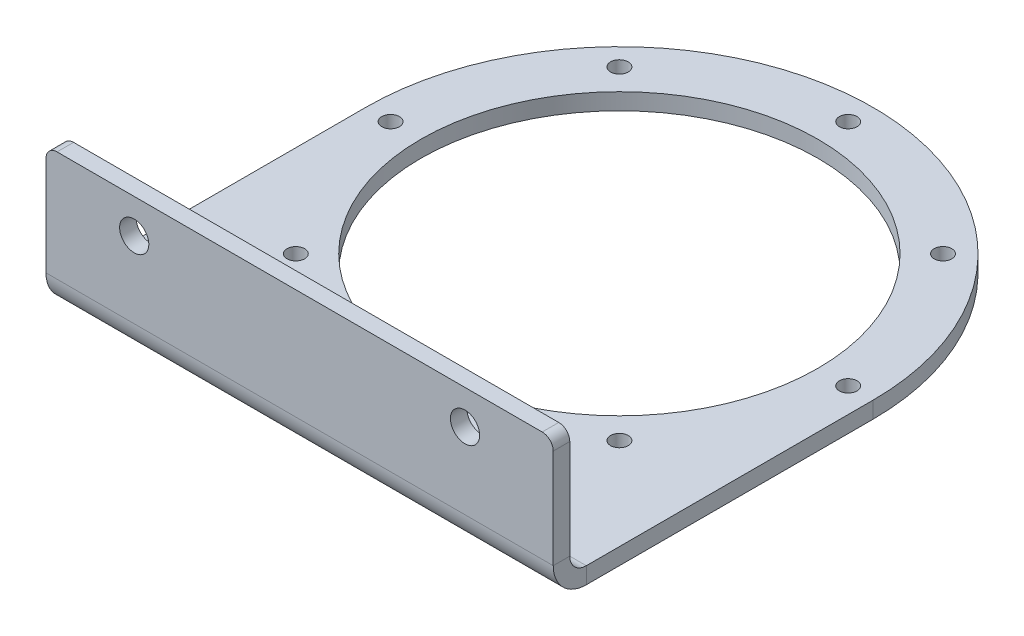
from build123d import *

# Parameters (mm, degrees)
SKETCH1_R                    = 36
SKETCH1_R_2                  = 1
BASE_FLANGE1_DEPTH           = 3
EDGE_FLANGE1_STRIP_W         = 18
EDGE_FLANGE1_STRIP_H         = 3
EDGE_FLANGE1_STRIP_CUT_DEPTH = 92
EDGE_FLANGE1_DEPTH           = 92
EDGE_FLANGE1_START           = 3
EDGE_FLANGE1_PROFILE_W       = 92
EDGE_FLANGE1_PROFILE_H       = 20
EDGE_FLANGE1_PROFILE_R       = 1
EDGE_FLANGE1_FLAT_DEPTH      = 3
FILLET1_R                    = 2
M3_CLEARANCE_HOLE1_D         = 3.2
M3_CLEARANCE_HOLE1_DEPTH     = 136
M3_CLEARANCE_HOLE1_TIP       = 0.96137699
M5_CLEARANCE_HOLE1_D         = 5.3
M5_CLEARANCE_HOLE1_DEPTH     = 136
M5_CLEARANCE_HOLE1_TIP       = 1.59228064


# Sheet-metal steps are written as plain solids
with BuildPart() as part:
    # Sketch1 → Base-Flange1 (new body)
    with BuildSketch(Plane(origin=(0, 0, 0), x_dir=(1, 0, 0), z_dir=(0, 1, 0))):
        with BuildLine():
            Line((-46, 0), (-46, -55))
            Line((-46, -55), (46, -55))
            Line((46, -55), (46, 0))
            ThreePointArc((46, 0), (0, 46), (-46, 0))
        make_face()
        with Locations(Location((0, 0, 0), (0, 0, 270))):
            Circle(SKETCH1_R, mode=Mode.SUBTRACT)
        with Locations(Location((0, 41.5, 0), (0, 0, 270))):
            Circle(SKETCH1_R_2, mode=Mode.SUBTRACT)
        with Locations(Location((29.344931419, 29.344931419, 0), (0, 0, 270))):
            Circle(SKETCH1_R_2, mode=Mode.SUBTRACT)
        with Locations(Location((41.5, 0, 0), (0, 0, 270))):
            Circle(SKETCH1_R_2, mode=Mode.SUBTRACT)
        with Locations(Location((29.344931419, -29.344931419, 0), (0, 0, 270))):
            Circle(SKETCH1_R_2, mode=Mode.SUBTRACT)
        with Locations(Location((0, -41.5, 0), (0, 0, 270))):
            Circle(SKETCH1_R_2, mode=Mode.SUBTRACT)
        with Locations(Location((-29.344931419, -29.344931419, 0), (0, 0, 270))):
            Circle(SKETCH1_R_2, mode=Mode.SUBTRACT)
        with Locations(Location((-41.5, 0, 0), (0, 0, 270))):
            Circle(SKETCH1_R_2, mode=Mode.SUBTRACT)
        with Locations(Location((-29.344931419, 29.344931419, 0), (0, 0, 270))):
            Circle(SKETCH1_R_2, mode=Mode.SUBTRACT)
    extrude(amount=-BASE_FLANGE1_DEPTH)

    # Edge-Flange1 strip (across the edge) → Edge-Flange1 strip cut (cut)
    with BuildSketch(Plane(origin=(-46, 0, 55), x_dir=(0, 0, -1), z_dir=(1, 0, 0))):
        with Locations((-6, -1.5)):
            Rectangle(EDGE_FLANGE1_STRIP_W, EDGE_FLANGE1_STRIP_H)
    extrude(amount=EDGE_FLANGE1_STRIP_CUT_DEPTH, mode=Mode.SUBTRACT)

    # Edge-Flange1 bend section (across the edge) → Edge-Flange1 (add)
    with BuildSketch(Plane(origin=(-46, 0, 55), x_dir=(0, 0, -1), z_dir=(1, 0, 0))):
        with BuildLine():
            Line((-3, 3), (0, 3))
            ThreePointArc((0, 3), (0.878679656, 0.878679656), (3, 0))
            Line((3, 0), (3, -3))
            ThreePointArc((3, -3), (-1.242640687, -1.242640687), (-3, 3))
        make_face()
    extrude(amount=EDGE_FLANGE1_DEPTH)

    # Edge-Flange1 profile (on flange) → Edge-Flange1 flat (add)
    with BuildSketch(Plane.XY.offset(55).offset(EDGE_FLANGE1_START)):
        with Locations((0, 13)):
            Rectangle(EDGE_FLANGE1_PROFILE_W, EDGE_FLANGE1_PROFILE_H)
        with Locations((-30, 16.8)):
            Circle(EDGE_FLANGE1_PROFILE_R, mode=Mode.SUBTRACT)
        with Locations((30, 16.8)):
            Circle(EDGE_FLANGE1_PROFILE_R, mode=Mode.SUBTRACT)
    extrude(amount=-EDGE_FLANGE1_FLAT_DEPTH)

    # Fillet1
    fillet1_edges = [part.edges().sort_by_distance(p)[0] for p in [
        (-46, 23, 56.5),
        (46, 23, 56.5),
    ]]
    fillet(fillet1_edges, radius=FILLET1_R)

    # M3 Clearance Hole1
    with Locations(Plane(origin=(0, 0, 0), x_dir=(1, 0, 0), z_dir=(0, 1, 0))):
        with Locations((0, 41.5), (29.344931419, 29.344931419), (41.5, 0), (29.344931419, -29.344931419), (0, -41.5), (-29.344931419, -29.344931419), (-41.5, 0), (-29.344931419, 29.344931419)):
            Hole(M3_CLEARANCE_HOLE1_D / 2, depth=M3_CLEARANCE_HOLE1_DEPTH)
            with Locations((0, 0, -(M3_CLEARANCE_HOLE1_DEPTH + M3_CLEARANCE_HOLE1_TIP / 2))):  # 118° drill point
                Cone(0, M3_CLEARANCE_HOLE1_D / 2, M3_CLEARANCE_HOLE1_TIP, mode=Mode.SUBTRACT)

    # M5 Clearance Hole1
    with Locations(Plane.XY.offset(58)):
        with Locations((30, 16.8), (-30, 16.8)):
            Hole(M5_CLEARANCE_HOLE1_D / 2, depth=M5_CLEARANCE_HOLE1_DEPTH)
            with Locations((0, 0, -(M5_CLEARANCE_HOLE1_DEPTH + M5_CLEARANCE_HOLE1_TIP / 2))):  # 118° drill point
                Cone(0, M5_CLEARANCE_HOLE1_D / 2, M5_CLEARANCE_HOLE1_TIP, mode=Mode.SUBTRACT)


solid = part.part
